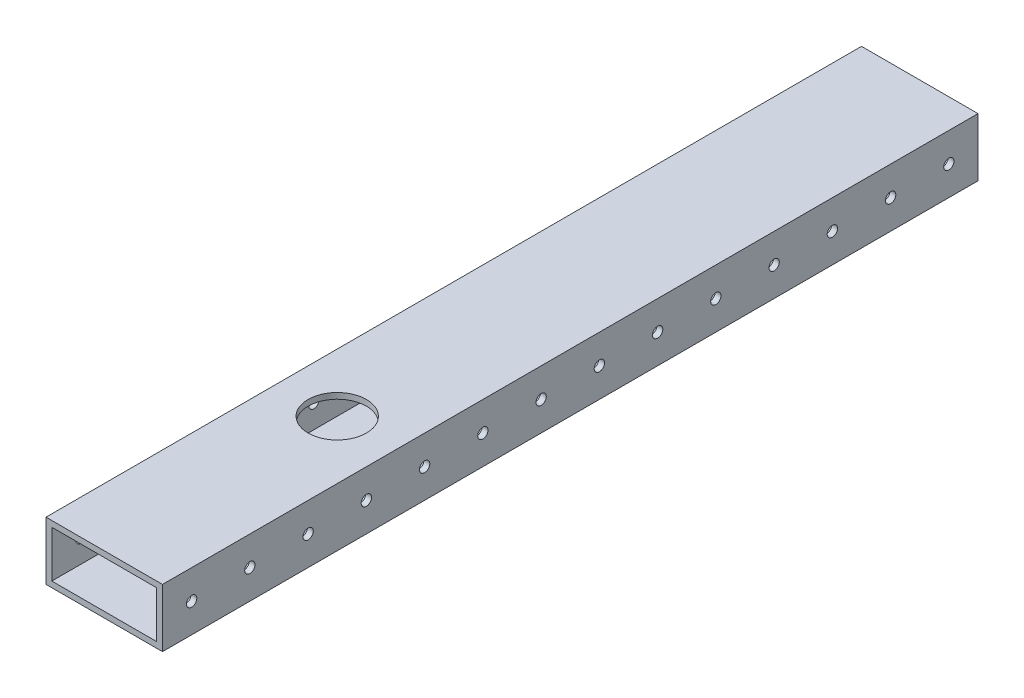
from build123d import *

# Parameters (mm, degrees)
SKETCH1_W              = 50.8
SKETCH1_H              = 25.4
SKETCH1_W_2            = 45.72
SKETCH1_H_2            = 20.32
BOSS_EXTRUDE1_DEPTH    = 355.6
F_8_CLEARANCE_HOLE1_D  = 4.4958
F_1_1_DIAMETER_HOLE1_D = 25.4


with BuildPart() as part:
    # Sketch1 → Boss-Extrude1 (new body)
    with BuildSketch(Plane.XY):
        Rectangle(SKETCH1_W, SKETCH1_H)
        Rectangle(SKETCH1_W_2, SKETCH1_H_2, mode=Mode.SUBTRACT)
    extrude(amount=-BOSS_EXTRUDE1_DEPTH)

    # #8 Clearance Hole1 (through all)
    with Locations(Plane(origin=(25.4, 0, 0), x_dir=(0, 0, -1), z_dir=(1, 0, 0))):
        with Locations((12.7, 0), (38.1, 0), (63.5, 0), (88.9, 0), (114.3, 0), (139.7, 0), (165.1, 0), (190.5, 0), (215.9, 0), (241.3, 0), (266.7, 0), (292.1, 0), (317.5, 0), (342.9, 0)):
            Hole(F_8_CLEARANCE_HOLE1_D / 2)

    # 1 (1) Diameter Hole1 (through all)
    with Locations(Plane(origin=(0, 12.7, 0), x_dir=(1, 0, 0), z_dir=(0, 1, 0))):
        with Locations((0, 101.6)):
            Hole(F_1_1_DIAMETER_HOLE1_D / 2)


solid = part.part
